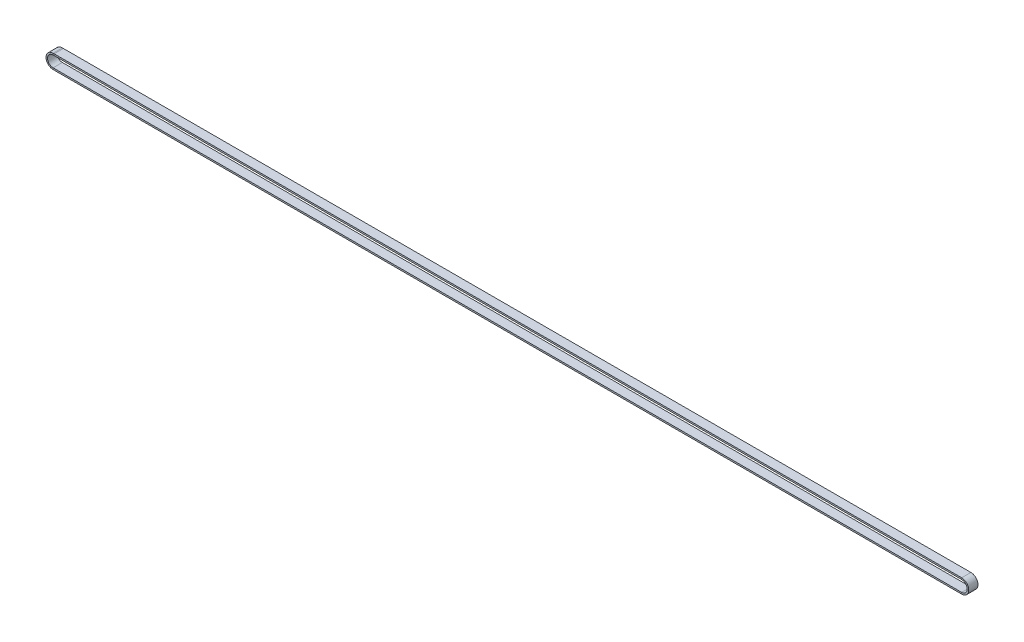
from build123d import *

# Parameters (mm, degrees)
SKETCH3_W = 9
SKETCH3_H = 1.5


with BuildPart() as part:
    # Sweep1: sweep along a path in Sketch2
    with BuildLine(Plane.XY.offset(-46.13)) as sweep1_path:
        Line((-1.00000001, 18.418605134), (883.520637828, 18.418605134))
        ThreePointArc((883.520637828, 18.418605134), (890.420637831, 11.518605136), (883.520637833, 4.618605134))
        Line((883.520637833, 4.618605134), (-1.000000006, 4.618605134))
        ThreePointArc((-1.000000006, 4.618605134), (-7.900000008, 11.518605132), (-1.00000001, 18.418605134))
    # Sketch3 → Sweep1 (sweep)
    with BuildSketch(Plane(origin=(0, 0, 0), x_dir=(0, 0, -1), z_dir=(1, 0, 0))):
        with Locations((41.63, 17.668605134)):
            Rectangle(SKETCH3_W, SKETCH3_H)
    sweep(path=sweep1_path.line)


solid = part.part
